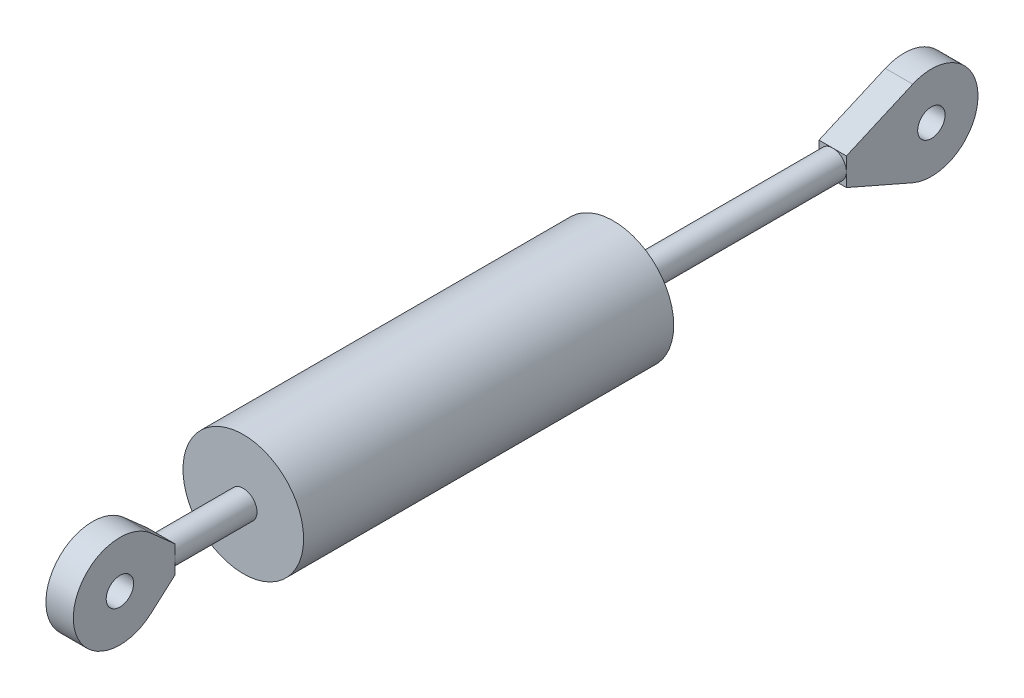
from build123d import *

# Parameters (mm, degrees)
SKETCH1_W                = 67.5
SKETCH1_H                = 11
SKETCH2_R                = 2.5
BOSS_EXTRUDE1_DEPTH      = 15
BOSS_EXTRUDE2_DEPTH      = 2.5
BOSS_EXTRUDE2_DEPTH_BACK = 2.5
SKETCH3_R                = 2.5
BOSS_EXTRUDE3_START      = 40
SKETCH4_R                = 2.5
BOSS_EXTRUDE3_DEPTH      = 40
BOSS_EXTRUDE4_DEPTH      = 2.5
BOSS_EXTRUDE4_DEPTH_BACK = 2.5
SKETCH5_R                = 2.5


with BuildPart() as part:
    # Sketch1 → Revolve1 (revolve)
    with BuildSketch(Plane(origin=(0, 0, 0), x_dir=(0, 0, -1), z_dir=(1, 0, 0))):
        with Locations((-0.842105263, 5.5)):
            Rectangle(SKETCH1_W, SKETCH1_H)
    revolve(axis=Axis((0, 0, 34.592105263), (0, 0, -1)))

    # Sketch2 → Boss-Extrude1 (add)
    with BuildSketch(Plane.XY.offset(34.592105263)):
        Circle(SKETCH2_R)
    extrude(amount=BOSS_EXTRUDE1_DEPTH)

    # Sketch3 → Boss-Extrude2 (add, two sides: drawn at the far end of the back side and taken through both)
    with BuildSketch(Plane(origin=(0, 0, 0), x_dir=(0, 0, -1), z_dir=(1, 0, 0)).offset(-BOSS_EXTRUDE2_DEPTH_BACK)):
        with BuildLine():
            Line((-49.592105263, 2.5), (-53.958295642, 6.364761516))
            ThreePointArc((-53.958295642, 6.364761516), (-68.092105263, 0), (-53.958295642, -6.364761516))
            Line((-53.958295642, -6.364761516), (-49.592105263, -2.5))
            Line((-49.592105263, -2.5), (-49.592105263, 2.5))
        make_face()
        with Locations((-59.592105263, 0)):
            Circle(SKETCH3_R, mode=Mode.SUBTRACT)
    extrude(amount=BOSS_EXTRUDE2_DEPTH + BOSS_EXTRUDE2_DEPTH_BACK)

    # Sketch4 → Boss-Extrude3 (add)
    with BuildSketch(Plane(origin=(0, 0, -32.907894737), x_dir=(-1, 0, 0), z_dir=(0, 0, -1)).offset(BOSS_EXTRUDE3_START)):
        Circle(SKETCH4_R)
    extrude(amount=-BOSS_EXTRUDE3_DEPTH)

    # Sketch5 → Boss-Extrude4 (add, two sides: drawn at the far end of the back side and taken through both)
    with BuildSketch(Plane(origin=(0, 0, 0), x_dir=(0, 0, -1), z_dir=(1, 0, 0)).offset(-BOSS_EXTRUDE4_DEPTH_BACK)):
        with BuildLine():
            Line((72.907894737, 2.5), (85.002754977, 7.788133487))
            ThreePointArc((85.002754977, 7.788133487), (96.907894737, 0), (85.002754977, -7.788133487))
            Line((85.002754977, -7.788133487), (72.907894737, -2.5))
            Line((72.907894737, -2.5), (72.907894737, 2.5))
        make_face()
        with Locations((88.407894737, 0)):
            Circle(SKETCH5_R, mode=Mode.SUBTRACT)
    extrude(amount=BOSS_EXTRUDE4_DEPTH + BOSS_EXTRUDE4_DEPTH_BACK)


solid = part.part
